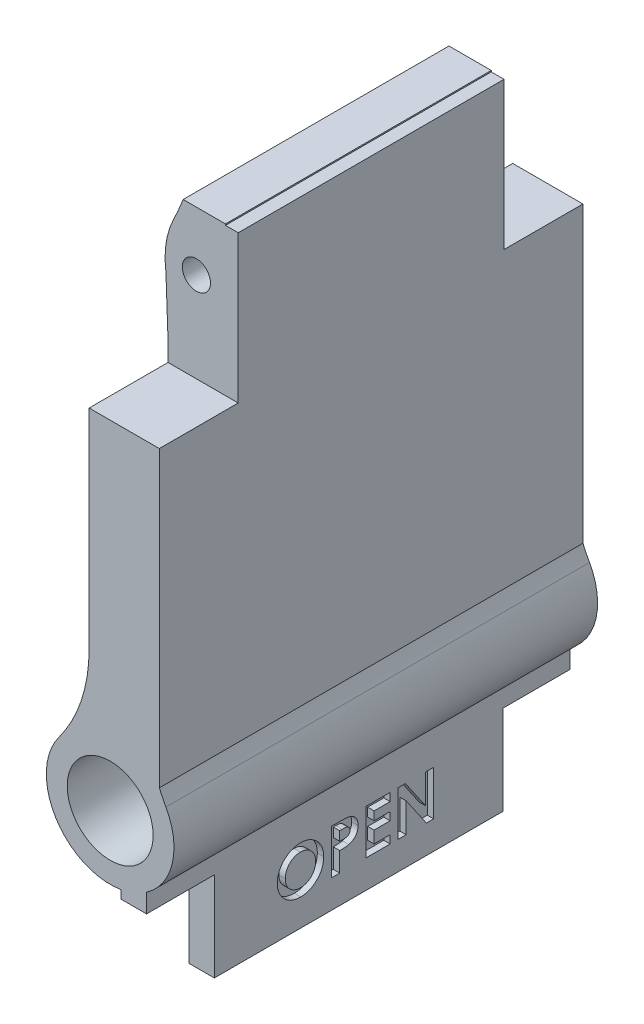
from build123d import *

# Parameters (mm, degrees)
SKETCH1_W              = 34.3
SKETCH1_H              = 45.51
BOSS_EXTRUDE1_DEPTH    = 2
CUT_EXTRUDE1_DEPTH     = 2
BOSS_EXTRUDE2_DEPTH    = 20.823149291
SKETCH4_R              = 1.1042547
CUT_EXTRUDE2_DEPTH     = 42.506603652
SKETCH5_R              = 5
BOSS_EXTRUDE3_DEPTH    = 33.783931913
SKETCH6_R              = 3.365
CUT_EXTRUDE3_DEPTH     = 13.462
BOSS_EXTRUDE4_DEPTH    = 2.5
BOSS_EXTRUDE5_DEPTH    = 20.823149291
BOSS_EXTRUDE6_DEPTH    = 33.783931913
FILLET2_R              = 12
FILLET3_R              = 12
FILLET4_R              = 12
SKETCH10_W             = 2
SKETCH10_H             = 20.823149292
CUT_EXTRUDE4_DEPTH     = 0.977216189
SKETCH11_W             = 2
SKETCH11_H             = 22.627416454
BOSS_EXTRUDE7_DEPTH    = 7
CUT_EXTRUDE5_START     = -0.3
CUT_EXTRUDE5_OUTLINE_W = 13
CUT_EXTRUDE5_OUTLINE_H = 35
CUT_EXTRUDE5_DEPTH     = 0.3
BOSS_EXTRUDE9_REACH    = 47.225
SKETCH14_W             = 1
SKETCH14_H             = 35.478225403
SKETCH17_W             = 1
SKETCH17_H             = 6.180391311
SKETCH17_H_2           = 6.18039131
CUT_EXTRUDE6_DEPTH     = 11.550006042
CUT_EXTRUDE7_DEPTH     = 0.5


# Read off the part's stored shape, not the designer's step: Cut-Extrude5
# Some blends are built 0.0001 mm under size
with BuildPart() as part:
    # Sketch1 → Boss-Extrude1 (new body)
    with BuildSketch(Plane(origin=(0, 0, 0), x_dir=(0, 0, -1), z_dir=(1, 0, 0))):
        with Locations((5.021538462, 8.387259615)):
            Rectangle(SKETCH1_W, SKETCH1_H)
    extrude(amount=BOSS_EXTRUDE1_DEPTH)

    # Sketch2 → Cut-Extrude1 (cut)
    with BuildSketch(Plane(origin=(2, 0, 0), x_dir=(0, 0, -1), z_dir=(1, 0, 0))):
        Polygon((-13.178866143, 32.544644862), (-5.132002141, 32.544644862), (-5.132002141, 18.515387093), (-11.612393451, 18.515387093), (-11.612393451, -13.557627361), (22.73510321, -13.557627361), (22.73510321, -15.238359526), (-11.612393451, -15.238359526), (-13.178866143, -15.238359526), (-13.178866143, 18.515387093), align=None)
    cut_extrude1 = extrude(amount=-CUT_EXTRUDE1_DEPTH, mode=Mode.SUBTRACT)

    # Mirror1: Cut-Extrude1 across plane
    add(cut_extrude1.mirror(Plane.XY.offset(-5.279572505)), mode=Mode.SUBTRACT)

    # Sketch3 → Boss-Extrude2 (add)
    with BuildSketch(Plane(origin=(0, 0, -15.691147151), x_dir=(-1, 0, 0), z_dir=(0, 0, -1))):
        with BuildLine():
            Line((1.315434856, 30.165043427), (0, 30.165043427))
            Line((0, 30.165043427), (0, 20.080058691))
            Line((0, 20.080058691), (1.315434856, 20.080058691))
            Line((1.315434856, 20.080058691), (2.402068159, 23.420561868))
            ThreePointArc((2.402068159, 23.420561868), (2.717041482, 25.991772745), (2.042807531, 28.492920911))
            ThreePointArc((2.042807531, 28.492920911), (1.660054562, 29.320688191), (1.315434856, 30.165043427))
        make_face()
    extrude(amount=-BOSS_EXTRUDE2_DEPTH)

    # Sketch4 → Cut-Extrude2 (cut, through all)
    with BuildSketch(Plane(origin=(0, 0, -15.691147151), x_dir=(-1, 0, 0), z_dir=(0, 0, -1))):
        with Locations((0.276230845, 25.559654414)):
            Circle(SKETCH4_R)
    extrude(amount=-CUT_EXTRUDE2_DEPTH, mode=Mode.SUBTRACT)

    # Sketch5 → Boss-Extrude3 (add)
    with BuildSketch(Plane(origin=(0, 0, -22.171538462), x_dir=(-1, 0, 0), z_dir=(0, 0, -1))):
        with Locations((0.851316537, -7.979689858)):
            Circle(SKETCH5_R)
    extrude(amount=-BOSS_EXTRUDE3_DEPTH)

    # Sketch6 → Cut-Extrude3 (cut)
    with BuildSketch(Plane(origin=(0, 0, -22.171538462), x_dir=(-1, 0, 0), z_dir=(0, 0, -1))):
        with Locations(Location((0.851316537, -7.979689858, 0), (0, 0, 90))):
            Circle(SKETCH6_R)
    cut_extrude3 = extrude(amount=-CUT_EXTRUDE3_DEPTH, mode=Mode.SUBTRACT)

    # Mirror2: Cut-Extrude3 across plane
    add(cut_extrude3.mirror(Plane.XY.offset(-5.279572505)), mode=Mode.SUBTRACT)

    # Sketch7 → Boss-Extrude4 (add)
    with BuildSketch(Plane.ZY):
        Polygon((11.612393451, -3.052696844), (11.612393451, 18.515387093), (5.132002141, 18.515387093), (5.132002141, 20.080058691), (-15.691147151, 20.080058691), (-15.691147151, 18.515387093), (-22.171538462, 18.515387093), (-22.171538462, -3.052696844), align=None)
    extrude(amount=BOSS_EXTRUDE4_DEPTH)

    # Sketch8 → Boss-Extrude5 (add)
    with BuildSketch(Plane(origin=(0, 0, -15.691147151), x_dir=(-1, 0, 0), z_dir=(0, 0, -1))):
        Polygon((2.663814513, 24.541991734), (2.5, 20.080058691), (1.315434856, 20.080058691), align=None)
    extrude(amount=-BOSS_EXTRUDE5_DEPTH)

    # Sketch9 → Boss-Extrude6 (add)
    with BuildSketch(Plane(origin=(0, 0, -22.171538462), x_dir=(-1, 0, 0), z_dir=(0, 0, -1))):
        Polygon((2.5, -3.052696844), (2.644283116, -3.312220431), (1.702633075, -3.052696844), align=None)
    extrude(amount=-BOSS_EXTRUDE6_DEPTH)

    # Fillet2
    # the kernel refuses this fillet: 12 mm, written as the material it adds along each edge
    with BuildSketch(Plane(origin=(-2.5, -3.052696844, -22.171538462), x_dir=(0, 1, 0), z_dir=(0, 0, 1))) as fillet2_piece_1:
        with BuildLine():
            CenterArc((1.595733046, 12), FILLET2_R, 261.106127999, 8.893872001)
            Line((-0.259523587, 0.144283116), (-0.296628719, -0.092831221))
            ThreePointArc((-0.296628719, -0.092831221), (-0.246379921, -0.137620717), (-0.116618128, -0.209762276))
            Line((-0.116618128, -0.209762276), (0, -0.24))
            Line((0, -0.24), (1.595733046, -0.24))
            Line((1.595733046, -0.24), (1.595733046, 0))
        make_face()
    extrude(amount=33.783931913)

    # Fillet3
    fillet3_edges = [part.edges().sort_by_distance(p)[0] for p in [
        (-2.644283116, -3.312220431, -5.279572505),
    ]]
    fillet(fillet3_edges, radius=FILLET3_R - 0.0001)  # a hair under: the kernel refuses the full size

    # Fillet4
    fillet4_edges = [part.edges().sort_by_distance(p)[0] for p in [
        (2, -3.872380032, -5.279572505),
    ]]
    fillet(fillet4_edges, radius=FILLET4_R)

    # Sketch10 → Cut-Extrude4 (cut)
    with BuildSketch(Plane(origin=(0, 31.142259615, 0), x_dir=(1, 0, 0), z_dir=(0, 1, 0))):
        with Locations((1, 5.279572505)):
            Rectangle(SKETCH10_W, SKETCH10_H)
    extrude(amount=-CUT_EXTRUDE4_DEPTH, mode=Mode.SUBTRACT)

    # Sketch11 → Boss-Extrude7 (add)
    with BuildSketch(Plane.XZ.offset(13.557627361)):
        with Locations((1, -5.309927391)):
            Rectangle(SKETCH11_W, SKETCH11_H)
    extrude(amount=BOSS_EXTRUDE7_DEPTH)

    # Cut-Extrude5 outline → Cut-Extrude5 (cut)
    with BuildSketch(Plane.XY.offset(11.612393451).offset(CUT_EXTRUDE5_START)):
        with Locations((-0.5, 2.5)):
            Rectangle(CUT_EXTRUDE5_OUTLINE_W, CUT_EXTRUDE5_OUTLINE_H)
    cut_extrude5 = extrude(amount=CUT_EXTRUDE5_DEPTH, mode=Mode.SUBTRACT)

    # Mirror3: Cut-Extrude5 across plane
    add(cut_extrude5.mirror(Plane.XY.offset(-5.279572505)), mode=Mode.SUBTRACT)

    # Boss-Extrude9: up to this face of the body (flat: up to its plane)
    boss_extrude9_end = Plane(part.part.faces().sort_by_distance((-0.43116515, 2.509526518, -21.871538462))[0])
    # Sketch14 → Boss-Extrude9 (add, up to the picked face)
    with BuildSketch(Plane.XY.offset(11.312393451), mode=Mode.PRIVATE) as boss_extrude9_sk1:
        with Locations((2.5, 12.326280433)):
            Rectangle(SKETCH14_W, SKETCH14_H)
    boss_extrude9_tool1 = split(extrude(boss_extrude9_sk1.sketch, amount=-BOSS_EXTRUDE9_REACH, mode=Mode.PRIVATE), bisect_by=boss_extrude9_end, keep=Keep.BOTH, mode=Mode.PRIVATE)
    add(boss_extrude9_tool1.solids().sort_by(Axis((2.5, 12.32628, 11.312393), (0, 0, -1)))[0])

    # Sketch17 → Cut-Extrude6 (cut)
    with BuildSketch(Plane(origin=(0, 30.065393135, 0), x_dir=(1, 0, 0), z_dir=(0, 1, 0))):
        with Locations((2.5, 18.781342806)):
            Rectangle(SKETCH17_W, SKETCH17_H)
        with Locations((2.5, -8.222197796)):
            Rectangle(SKETCH17_W, SKETCH17_H_2)
    extrude(amount=-CUT_EXTRUDE6_DEPTH, mode=Mode.SUBTRACT)

    # Sketch18 → Cut-Extrude7 (cut)
    # profile 1 of 4: a face of its own
    with BuildSketch(Plane(origin=(2, 0, 0), x_dir=(0, 0, -1), z_dir=(1, 0, 0))):
        with BuildLine():
            add(Edge.make_bspline(
                [(0.753352248, -14.760702933), (0.814204037, -14.762278495), (0.934339252, -14.765389011), (1.111014801, -14.791317588), (1.28127436, -14.833564487), (1.445040938, -14.892290733), (1.601904481, -14.969086931), (1.752418301, -15.061775858), (1.896043264, -15.172106962), (2.031307616, -15.2975064), (2.156316273, -15.433872813), (2.264636348, -15.580695501), (2.357007733, -15.734170141), (2.433565385, -15.894707971), (2.491878286, -16.063420794), (2.532798861, -16.239448397), (2.559088303, -16.422740701), (2.562111993, -16.547537776), (2.563648722, -16.61096335)],
                knots=[0, 0, 0, 0, 1.014329547, 2.002516266, 2.970391464, 3.935626869, 4.897733899, 5.877609409, 6.878433252, 7.912639331, 8.949961323, 9.958554974, 10.949718813, 11.932905612, 12.9188844, 13.919928257, 14.942845884, 16, 16, 16, 16], degree=3))
            add(Edge.make_bspline(
                [(2.563648722, -16.61096335), (2.562012172, -16.673674263), (2.558787298, -16.79724813), (2.533872111, -16.978851323), (2.492262428, -17.152993303), (2.43493856, -17.320068245), (2.359769375, -17.479266893), (2.269199332, -17.631605711), (2.16083846, -17.775670957), (2.038639105, -17.911385319), (1.904108221, -18.034575225), (1.761618657, -18.143136116), (1.611828344, -18.235126518), (1.454956527, -18.310504296), (1.2906668, -18.369002213), (1.11936498, -18.410276744), (0.941061668, -18.43536011), (0.819806769, -18.43856392), (0.7582601, -18.440190113)],
                knots=[0, 0, 0, 0, 1.051557043, 2.072126891, 3.067553643, 4.050577992, 5.02905126, 6.015227836, 7.017913613, 8.04756643, 9.074058332, 10.072836633, 11.047628519, 12.017157415, 12.98668631, 13.966869689, 14.968021931, 16, 16, 16, 16], degree=3))
            add(Edge.make_bspline(
                [(0.7582601, -18.440190113), (0.693889665, -18.438731338), (0.567410558, -18.435865045), (0.38230782, -18.408607905), (0.204963402, -18.367549132), (0.0368671, -18.306271115), (-0.123693003, -18.229668441), (-0.275537225, -18.135327656), (-0.418614537, -18.023404665), (-0.552104222, -17.896765857), (-0.673046201, -17.758195225), (-0.779801219, -17.61180764), (-0.869851446, -17.458721376), (-0.943200175, -17.298864784), (-1.001025367, -17.133231334), (-1.041814469, -16.96081227), (-1.065909565, -16.782021117), (-1.069265872, -16.660582592), (-1.070966663, -16.599044279)],
                knots=[0, 0, 0, 0, 1.067978421, 2.098431617, 3.099715153, 4.085208694, 5.062210972, 6.048429807, 7.046490867, 8.072918869, 9.098532598, 10.095778865, 11.076610158, 12.041847152, 13.011192615, 13.984257998, 14.978533688, 16, 16, 16, 16], degree=3))
            add(Edge.make_bspline(
                [(-1.070966663, -16.599044279), (-1.070432857, -16.557644524), (-1.069372004, -16.475369229), (-1.056592915, -16.353441441), (-1.038194701, -16.23389352), (-1.010984615, -16.117202105), (-0.977931315, -16.002543992), (-0.935106096, -15.890986448), (-0.886359408, -15.781337731), (-0.829403492, -15.67489293), (-0.766074021, -15.572631425), (-0.696975929, -15.475035603), (-0.621935471, -15.383285539), (-0.541194377, -15.29677829), (-0.454474402, -15.216082474), (-0.362916257, -15.14005573), (-0.264744248, -15.070717598), (-0.162107052, -15.006374703), (-0.055583314, -14.948190538), (0.054393318, -14.898665918), (0.165557107, -14.85541691), (0.279393054, -14.821282881), (0.394681201, -14.793481071), (0.512653171, -14.775095257), (0.632243153, -14.762316522), (0.712886744, -14.761242073), (0.753352248, -14.760702933)],
                knots=[0, 0, 0, 0, 1.034744296, 2.056386356, 3.06226378, 4.057406941, 5.050368692, 6.043467995, 7.042652155, 8.049140477, 9.059438543, 10.048523776, 11.036952808, 12.020949711, 13.004946614, 13.997082645, 14.994316842, 16.007702937, 17.024872941, 18.026463647, 19.021641123, 20.005082605, 20.995858141, 21.984425357, 22.988620895, 24, 24, 24, 24], degree=3))
        make_face()
        with BuildLine():
            add(Edge.make_bspline(
                [(0.743536543, -15.388908061), (0.702583296, -15.390006929), (0.621757976, -15.392175654), (0.503201951, -15.408698403), (0.38938398, -15.435087113), (0.280935002, -15.473310836), (0.177384988, -15.521959935), (0.078550377, -15.580864423), (-0.014200176, -15.652049076), (-0.10210341, -15.731692307), (-0.181509518, -15.820433171), (-0.251667319, -15.915534098), (-0.310378098, -16.016836271), (-0.359548743, -16.123398619), (-0.396563342, -16.236419405), (-0.42292773, -16.355013326), (-0.43958904, -16.479384724), (-0.441689218, -16.564168545), (-0.442761534, -16.607457741)],
                knots=[0, 0, 0, 0, 1.033739768, 2.040188636, 3.016340934, 3.979330865, 4.937572243, 5.900995986, 6.878200029, 7.884839167, 8.891893314, 9.879764717, 10.863503415, 11.843163062, 12.837761627, 13.859916423, 14.907309254, 16, 16, 16, 16], degree=3))
            add(Edge.make_bspline(
                [(-0.442761534, -16.607457741), (-0.441339807, -16.655431907), (-0.438553457, -16.749453324), (-0.41894836, -16.886609234), (-0.38540599, -17.016139379), (-0.336971459, -17.137410245), (-0.276899935, -17.251768455), (-0.202300636, -17.357812386), (-0.114381717, -17.456176981), (-0.046649694, -17.513606328), (-0.012272752, -17.542754215)],
                knots=[0, 0, 0, 0, 1.078454662, 2.113592447, 3.107694534, 4.079536787, 5.043276885, 6.005368276, 6.987637804, 8, 8, 8, 8], degree=3))
            add(Edge.make_bspline(
                [(-0.012272752, -17.542754215), (0.015888526, -17.564287555), (0.071576605, -17.606869084), (0.160466903, -17.661446049), (0.252006406, -17.708223952), (0.346885895, -17.746019944), (0.44490499, -17.775749637), (0.546050249, -17.796568852), (0.650178357, -17.809634709), (0.720594664, -17.811196327), (0.756156735, -17.811984984)],
                knots=[0, 0, 0, 0, 1.023928204, 2.024787132, 3.009472467, 3.9914905, 4.972207045, 5.96565515, 6.972602802, 8, 8, 8, 8], degree=3))
            add(Edge.make_bspline(
                [(0.756156735, -17.811984984), (0.796405789, -17.8108768), (0.875597069, -17.808696411), (0.99194611, -17.792377066), (1.103412024, -17.764758841), (1.210686803, -17.726870429), (1.313461113, -17.677610499), (1.411232668, -17.616878979), (1.504172889, -17.545421573), (1.591964136, -17.464732452), (1.672209485, -17.375642011), (1.742220881, -17.280033825), (1.80279837, -17.180014429), (1.850946511, -17.074168201), (1.889423473, -16.963494278), (1.915470552, -16.84750251), (1.932272612, -16.72667106), (1.934373382, -16.644440987), (1.935443594, -16.602549888)],
                knots=[0, 0, 0, 0, 1.026359118, 2.019393844, 2.989460624, 3.950973911, 4.916101784, 5.890408035, 6.881132271, 7.902007068, 8.92769091, 9.933912415, 10.920395702, 11.90457117, 12.894218921, 13.903490204, 14.931958862, 16, 16, 16, 16], degree=3))
            add(Edge.make_bspline(
                [(1.935443594, -16.602549888), (1.934336353, -16.560899674), (1.932156917, -16.47891758), (1.915808849, -16.358396786), (1.888365771, -16.242917088), (1.850363585, -16.132289895), (1.801836806, -16.026406752), (1.74182852, -15.925640006), (1.67054929, -15.830087074), (1.589639602, -15.740399113), (1.50157438, -15.657981621), (1.407027565, -15.586458221), (1.308644682, -15.52430666), (1.204168349, -15.475619637), (1.095736063, -15.436830788), (0.982686166, -15.408266124), (0.864590474, -15.392291727), (0.784247533, -15.390046003), (0.743536543, -15.388908061)],
                knots=[0, 0, 0, 0, 1.055025985, 2.07665775, 3.074803781, 4.057872707, 5.035505728, 6.020516407, 7.023567878, 8.050795229, 9.077271434, 10.074415901, 11.050397877, 12.019801805, 12.988065821, 13.964604439, 14.968634123, 16, 16, 16, 16], degree=3))
        make_face(mode=Mode.SUBTRACT)
    # profile 2 of 4: a face of its own
    with BuildSketch(Plane(origin=(2, 0, 0), x_dir=(0, 0, -1), z_dir=(1, 0, 0))):
        with BuildLine():
            Line((3.19185385, -14.850446523), (3.892975645, -14.850446523))
            add(Edge.make_bspline(
                [(3.892975645, -14.850446523), (3.938786034, -14.85065158), (4.027163876, -14.851047178), (4.154611995, -14.85584433), (4.272189125, -14.864441119), (4.379868253, -14.875065391), (4.477605104, -14.889960207), (4.565522073, -14.907035947), (4.643637406, -14.927839169), (4.712831969, -14.952532304), (4.774931855, -14.981644546), (4.833698375, -15.012651162), (4.887803401, -15.049656464), (4.939977776, -15.088672178), (4.987238602, -15.133425461), (5.032534292, -15.180937916), (5.073946449, -15.233093849), (5.111666963, -15.289261926), (5.145885281, -15.348404401), (5.175780693, -15.410627003), (5.200030177, -15.476028193), (5.220372479, -15.544184899), (5.236711614, -15.615094152), (5.247587462, -15.689192049), (5.254974886, -15.765961211), (5.255626724, -15.818210351), (5.255956414, -15.844637228)],
                knots=[0, 0, 0, 0, 1.698747864, 3.27724071, 4.728299578, 6.070144658, 7.288476769, 8.393259625, 9.389771311, 10.283485332, 11.113357557, 11.931608583, 12.74405601, 13.541433047, 14.344816069, 15.154114104, 15.974336324, 16.810834471, 17.661136416, 18.50621059, 19.367396281, 20.244825668, 21.142564693, 22.063065223, 23.020325768, 24, 24, 24, 24], degree=3))
            add(Edge.make_bspline(
                [(5.255956414, -15.844637228), (5.255479394, -15.873872652), (5.254541989, -15.931323853), (5.245352403, -16.015540266), (5.229653686, -16.095832991), (5.209136284, -16.17287915), (5.180526226, -16.245411165), (5.147840579, -16.31515967), (5.107626865, -16.380169132), (5.061676268, -16.441252741), (5.011492974, -16.498907136), (4.955885634, -16.551467654), (4.895914147, -16.5992926), (4.831925667, -16.642883182), (4.763679961, -16.682151469), (4.691226274, -16.717465166), (4.614069849, -16.747694831), (4.560340436, -16.763504701), (4.533099844, -16.771520241)],
                knots=[0, 0, 0, 0, 1.102006807, 2.165578795, 3.188629044, 4.184801286, 5.166646146, 6.124351954, 7.085497154, 8.042432466, 9.003981491, 9.963833307, 10.922997304, 11.89326795, 12.880200226, 13.889073926, 14.929769137, 16, 16, 16, 16], degree=3))
            add(Edge.make_bspline(
                [(4.533099844, -16.771520241), (4.515157623, -16.775984294), (4.476288995, -16.785654872), (4.411972091, -16.795472935), (4.337853612, -16.804500041), (4.253693885, -16.812257746), (4.159444389, -16.817531177), (4.055196383, -16.821649493), (3.940902623, -16.824643933), (3.861427262, -16.824750189), (3.820058978, -16.824805497)],
                knots=[0, 0, 0, 0, 0.618981996, 1.340914327, 2.176866532, 3.120127938, 4.170906482, 5.338178032, 6.614476169, 8, 8, 8, 8], degree=3))
            Line((3.820058978, -16.824805497), (3.820058978, -18.350446523))
            Line((3.820058978, -18.350446523), (3.19185385, -18.350446523))
            Line((3.19185385, -18.350446523), (3.19185385, -14.850446523))
        make_face()
        with BuildLine():
            Line((3.820058978, -16.196600369), (4.042314587, -16.196600369))
            add(Edge.make_bspline(
                [(4.042314587, -16.196600369), (4.082757504, -16.196343929), (4.157173072, -16.195872077), (4.25879846, -16.189048816), (4.340466576, -16.178628319), (4.404985904, -16.163682915), (4.455930025, -16.141001287), (4.49986614, -16.114762913), (4.537551267, -16.081585211), (4.57018104, -16.043674009), (4.596267561, -16.000112138), (4.614357204, -15.951608918), (4.626107881, -15.899183453), (4.627193165, -15.8626988), (4.627751286, -15.843936106)],
                knots=[0, 0, 0, 0, 1.8619151, 3.425951444, 4.686033666, 5.651700536, 6.461346321, 7.243864085, 7.999046032, 8.762387399, 9.539336099, 10.322741239, 11.137448474, 12, 12, 12, 12], degree=3))
            add(Edge.make_bspline(
                [(4.627751286, -15.843936106), (4.627198906, -15.827543385), (4.626127156, -15.795737563), (4.618253788, -15.749833874), (4.605705904, -15.707042166), (4.587524503, -15.667809343), (4.564020256, -15.632202066), (4.535363823, -15.600234363), (4.501922921, -15.571221619), (4.47610459, -15.55586473), (4.462987664, -15.548062709)],
                knots=[0, 0, 0, 0, 1.102301479, 2.1387299, 3.123554645, 4.094223062, 5.036071848, 5.982632524, 6.975082478, 8, 8, 8, 8], degree=3))
            add(Edge.make_bspline(
                [(4.462987664, -15.548062709), (4.451876871, -15.542443662), (4.428353044, -15.530546988), (4.388289687, -15.516716235), (4.342057184, -15.505048471), (4.289343414, -15.49536434), (4.230358669, -15.487848448), (4.16511347, -15.482100672), (4.093511805, -15.479789267), (4.043717131, -15.479041315), (4.017775325, -15.478651651)],
                knots=[0, 0, 0, 0, 0.656809284, 1.390599849, 2.23162475, 3.173112763, 4.218524733, 5.370385145, 6.63003504, 8, 8, 8, 8], degree=3))
            Line((4.017775325, -15.478651651), (3.820058978, -15.478651651))
            Line((3.820058978, -15.478651651), (3.820058978, -16.196600369))
        make_face(mode=Mode.SUBTRACT)
    # profile 3 of 4: a face of its own
    with BuildSketch(Plane(origin=(2, 0, 0), x_dir=(0, 0, -1), z_dir=(1, 0, 0))):
        Polygon((5.884161543, -14.850446523), (7.768776927, -14.850446523), (7.768776927, -15.478651651), (6.512366671, -15.478651651), (6.512366671, -16.151728574), (7.768776927, -16.151728574), (7.768776927, -16.779933702), (6.512366671, -16.779933702), (6.512366671, -17.722241395), (7.768776927, -17.722241395), (7.768776927, -18.350446523), (5.884161543, -18.350446523), align=None)
    # profile 4 of 4: a face of its own
    with BuildSketch(Plane(origin=(2, 0, 0), x_dir=(0, 0, -1), z_dir=(1, 0, 0))):
        Polygon((8.396982055, -14.850446523), (8.962787344, -14.850446523), (10.550828209, -17.153631619), (10.550828209, -14.850446523), (11.179033337, -14.850446523), (11.179033337, -18.350446523), (10.609021318, -18.350446523), (9.025187184, -16.054272645), (9.025187184, -18.350446523), (8.396982055, -18.350446523), align=None)
    extrude(amount=-CUT_EXTRUDE7_DEPTH, mode=Mode.SUBTRACT)


solid = part.part
